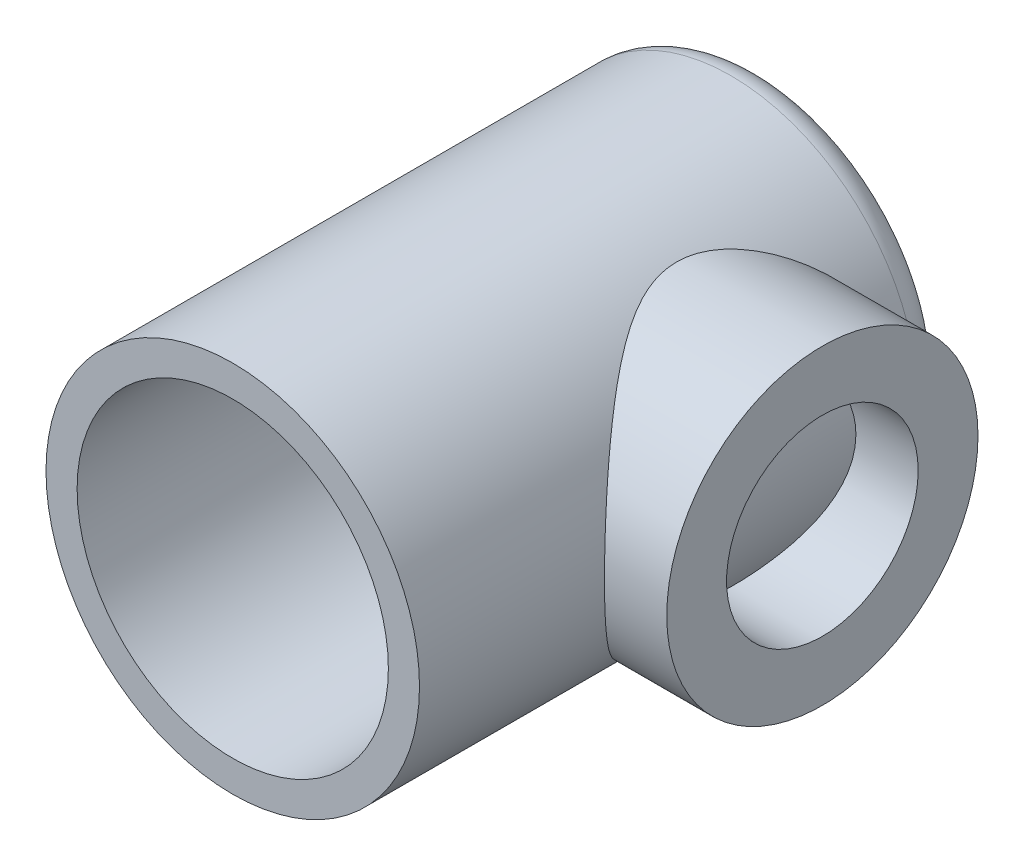
from build123d import *

# Parameters (mm, degrees)
SKETCH2_R                = 3
SKETCH2_R_2              = 2.5
BOSS_EXTRUDE1_DEPTH      = 8
BOSS_EXTRUDE6_REACH      = 11.394
BOSS_EXTRUDE6_END_RADIUS = 3
SKETCH7_R                = 2.5
SKETCH7_R_2              = 1.539100033
SKETCH8_R                = 3
BOSS_EXTRUDE7_DEPTH      = 0.5


with BuildPart() as part:
    # Sketch2 → Boss-Extrude1 (new body)
    with BuildSketch(Plane.XY.offset(8)):
        Circle(SKETCH2_R)
        Circle(SKETCH2_R_2, mode=Mode.SUBTRACT)
    extrude(amount=-BOSS_EXTRUDE1_DEPTH)

    # Boss-Extrude6: up to this cylinder (the profile starts outside it)
    boss_extrude6_end = Plane(origin=(0, 0, 4.957209), z_dir=(0, 0, 1)) * Cylinder(BOSS_EXTRUDE6_END_RADIUS, 29.788, mode=Mode.PRIVATE)
    # Sketch7 → Boss-Extrude6 (add, up to the surface)
    with BuildSketch(Plane(origin=(4, 0, 2.500950228), x_dir=(0, 0, -1), z_dir=(1, 0, 0)), mode=Mode.PRIVATE) as boss_extrude6_sk1:
        with Locations((-0.026969657, 0)):
            Circle(SKETCH7_R)
        with Locations((-0.026969657, 0)):
            Circle(SKETCH7_R_2, mode=Mode.SUBTRACT)
    boss_extrude6_tool1 = extrude(boss_extrude6_sk1.sketch, amount=-BOSS_EXTRUDE6_REACH, mode=Mode.PRIVATE) - boss_extrude6_end
    add(boss_extrude6_tool1.solids().sort_by_distance((4, 0, 4.957209))[0])

    # Sketch8 → Boss-Extrude7 (add)
    with BuildSketch(Plane(origin=(0, 0, 0), x_dir=(-1, 0, 0), z_dir=(0, 0, -1))):
        with Locations(Location((0, 0, 0), (0, 0, 180))):
            Circle(SKETCH8_R)
    extrude(amount=BOSS_EXTRUDE7_DEPTH)

    # Fillet2: read off the stored shape, not the designer's step
    # Fillet2 outline → Fillet2 (revolve, cut)
    with BuildSketch(Plane.XZ):
        with BuildLine():
            Line((3, -0.5), (3, 0))
            ThreePointArc((3, 0), (2.853553391, -0.353553391), (2.5, -0.5))
            Line((2.5, -0.5), (3, -0.5))
        make_face()
    revolve(axis=Axis((0, 0, 0), (0, 0, 1)), mode=Mode.SUBTRACT)


solid = part.part
